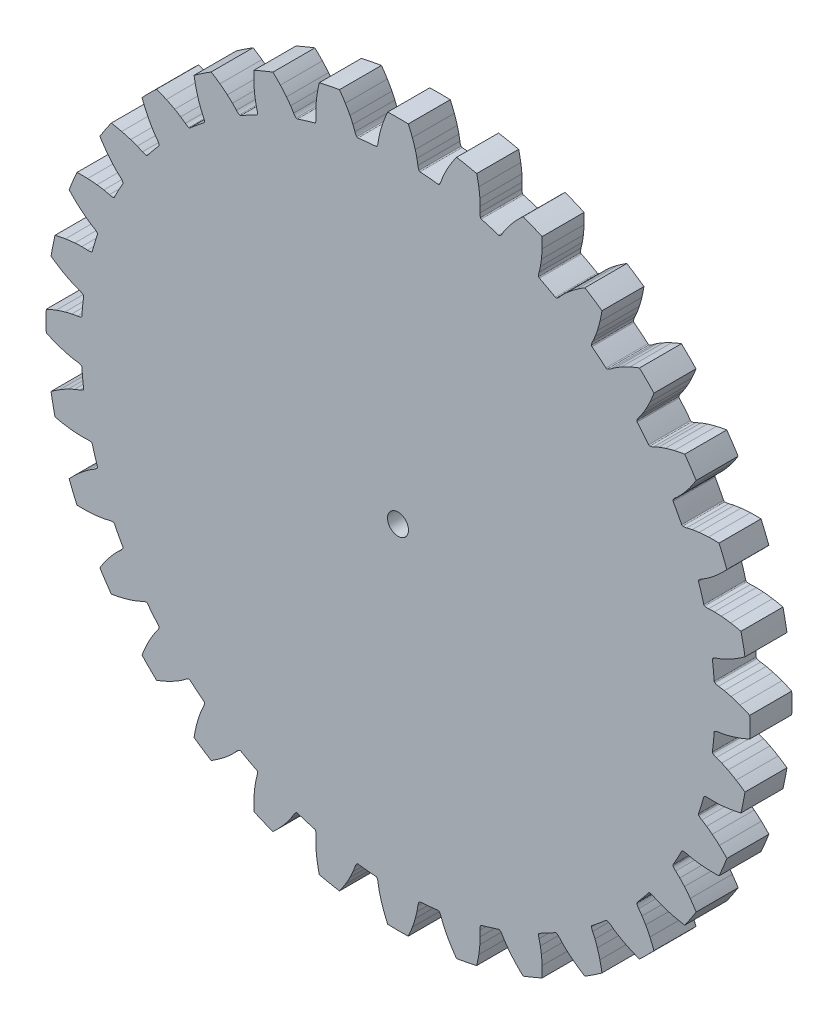
from build123d import *

# Parameters (mm, degrees)
BOSS_EXTRUDE1_DEPTH = 6.35
SKETCH2_R           = 1.5875
CUT_EXTRUDE1_DEPTH  = 76.509747374


with BuildPart() as part:
    # Model → Boss-Extrude1 (new body)
    with BuildSketch(Plane.XY):
        with BuildLine():
            ThreePointArc((47.688684308, -4.696925442), (47.750668499, -4.0181311), (47.802991315, -3.338523772))
            ThreePointArc((47.802991315, -3.338523772), (47.836540789, -3.240219855), (47.914385854, -3.171449418))
            ThreePointArc((47.914385854, -3.171449418), (48.187811806, -3.062492558), (48.475756522, -3.001491007))
            ThreePointArc((48.475756522, -3.001491007), (48.904401032, -2.939153054), (49.330070734, -2.858981734))
            ThreePointArc((49.330070734, -2.858981734), (49.842301009, -2.742156063), (50.350208962, -2.60777748))
            ThreePointArc((50.350208962, -2.60777748), (51.029288231, -2.400648092), (51.699447533, -2.166260071))
            ThreePointArc((51.699447533, -2.166260071), (52.446034926, -1.872790357), (53.181655372, -1.552821976))
            ThreePointArc((53.181655372, -1.552821976), (53.204320541, 0), (53.181655372, 1.552821976))
            ThreePointArc((53.181655372, 1.552821976), (52.446034933, 1.872790354), (51.699447549, 2.166260065))
            ThreePointArc((51.699447549, 2.166260065), (51.029288253, 2.400648085), (50.350208991, 2.607777472))
            ThreePointArc((50.350208991, 2.607777472), (49.84230104, 2.742156056), (49.330070766, 2.858981727))
            ThreePointArc((49.330070766, 2.858981727), (48.904401064, 2.939153049), (48.475756554, 3.001491003))
            ThreePointArc((48.475756554, 3.001491003), (48.187811841, 3.062492546), (47.914385887, 3.171449391))
            ThreePointArc((47.914385887, 3.171449391), (47.836540814, 3.24021982), (47.802991318, 3.338523731))
            ThreePointArc((47.802991318, 3.338523731), (47.68868431, 4.696925421), (47.535783919, 6.051525995))
            ThreePointArc((47.535783919, 6.051525995), (47.549510606, 6.154486207), (47.612443453, 6.237122059))
            ThreePointArc((47.612443453, 6.237122059), (47.859359173, 6.397328101), (48.1298703, 6.513332751))
            ThreePointArc((48.1298703, 6.513332751), (48.538116994, 6.658097293), (48.939966924, 6.819772183))
            ThreePointArc((48.939966924, 6.819772183), (49.419563281, 7.034284251), (49.891495964, 7.265168713))
            ThreePointArc((49.891495964, 7.265168713), (50.517117975, 7.600799961), (51.12867352, 7.961425877))
            ThreePointArc((51.12867352, 7.961425877), (51.803662344, 8.394908626), (52.462725316, 8.852241335))
            ThreePointArc((52.462725316, 8.852241335), (52.182014441, 10.379648027), (51.856844238, 11.898211209))
            ThreePointArc((51.856844238, 11.898211209), (51.072935805, 12.068519056), (50.283440788, 12.210697855))
            ThreePointArc((50.283440788, 12.210697855), (49.58043158, 12.309840583), (48.873991697, 12.380508245))
            ThreePointArc((48.873991697, 12.380508245), (48.349627093, 12.413216856), (47.824447623, 12.427866586))
            ThreePointArc((47.824447623, 12.427866586), (47.391316396, 12.423453399), (46.958746639, 12.400969151))
            ThreePointArc((46.958746639, 12.400969151), (46.664433891, 12.404623339), (46.375005314, 12.458143852))
            ThreePointArc((46.375005314, 12.458143852), (46.285239567, 12.510406057), (46.233156574, 12.600275903))
            ThreePointArc((46.233156574, 12.600275903), (45.856034921, 13.910276095), (45.441803005, 15.209019012))
            ThreePointArc((45.441803005, 15.209019012), (45.435179397, 15.312678816), (45.480781552, 15.406004433))
            ThreePointArc((45.480781552, 15.406004433), (45.691698208, 15.611303028), (45.934380154, 15.777852784))
            ThreePointArc((45.934380154, 15.777852784), (46.306540342, 15.999480695), (46.669127631, 16.236446079))
            ThreePointArc((46.669127631, 16.236446079), (47.09765945, 16.540400966), (47.515480755, 16.858918547))
            ThreePointArc((47.515480755, 16.858918547), (48.063603207, 17.310153534), (48.593053257, 17.783158692))
            ThreePointArc((48.593053257, 17.783158692), (49.170504071, 18.339995979), (49.727682147, 18.917117976))
            ThreePointArc((49.727682147, 18.917117976), (49.154382789, 20.360412001), (48.53920366, 21.786358858))
            ThreePointArc((48.53920366, 21.786358858), (47.737132396, 21.800461339), (46.935069596, 21.785885375))
            ThreePointArc((46.935069596, 21.785885375), (46.226226726, 21.74597281), (45.51957431, 21.677463029))
            ThreePointArc((45.51957431, 21.677463029), (44.998904092, 21.607244694), (44.480957778, 21.519155501))
            ThreePointArc((44.480957778, 21.519155501), (44.057010016, 21.430327401), (43.637138424, 21.323885009))
            ThreePointArc((43.637138424, 21.323885009), (43.347767917, 21.270051415), (43.053459295, 21.266078831))
            ThreePointArc((43.053459295, 21.266078831), (42.955222521, 21.299824404), (42.886607551, 21.377806538))
            ThreePointArc((42.886607551, 21.377806538), (42.261163825, 22.589062659), (41.601519086, 23.782037958))
            ThreePointArc((41.601519086, 23.782037958), (41.574799724, 23.882413766), (41.601318722, 23.982842696))
            ThreePointArc((41.601318722, 23.982842696), (41.768130904, 24.225344334), (41.97365754, 24.436038783))
            ThreePointArc((41.97365754, 24.436038783), (42.295429313, 24.726013026), (42.604819936, 25.029162458))
            ThreePointArc((42.604819936, 25.029162458), (42.965818979, 25.410879347), (43.313472268, 25.804789596))
            ThreePointArc((43.313472268, 25.804789596), (43.763031121, 26.354287614), (44.190029209, 26.921494692))
            ThreePointArc((44.190029209, 26.921494692), (44.647750902, 27.580287572), (45.081632041, 28.255020382))
            ThreePointArc((45.081632041, 28.255020382), (44.237775773, 29.558736761), (43.356228707, 30.837268954))
            ThreePointArc((43.356228707, 30.837268954), (42.566817759, 30.694624119), (41.783010001, 30.523853538))
            ThreePointArc((41.783010001, 30.523853538), (41.095573903, 30.346419498), (40.415865211, 30.141365065))
            ThreePointArc((40.415865211, 30.141365065), (39.918898443, 29.970918235), (39.42808967, 29.783475339))
            ThreePointArc((39.42808967, 29.783475339), (39.029617448, 29.613645941), (38.638579452, 29.427335925))
            ThreePointArc((38.638579452, 29.427335925), (38.365271531, 29.318083343), (38.07739298, 29.256770328))
            ThreePointArc((38.07739298, 29.256770328), (37.974460363, 29.270702445), (37.891950251, 29.333800058))
            ThreePointArc((37.891950251, 29.333800058), (37.042219904, 30.399764214), (36.162512118, 31.441126522))
            ThreePointArc((36.162512118, 31.441126522), (36.116723813, 31.534360948), (36.123140543, 31.638033764))
            ThreePointArc((36.123140543, 31.638033764), (36.239437753, 31.908419244), (36.399910804, 32.155161515))
            ThreePointArc((36.399910804, 32.155161515), (36.658928655, 32.502338544), (36.903232904, 32.860022161))
            ThreePointArc((36.903232904, 32.860022161), (37.182826181, 33.304831886), (37.446951331, 33.758997052))
            ThreePointArc((37.446951331, 33.758997052), (37.780670292, 34.385641202), (38.08880712, 35.025252749))
            ThreePointArc((38.08880712, 35.025252749), (38.409209704, 35.760684181), (38.703120097, 36.5070982))
            ThreePointArc((38.703120097, 36.5070982), (37.621135843, 37.621135843), (36.5070982, 38.703120097))
            ThreePointArc((36.5070982, 38.703120097), (35.760684189, 38.409209707), (35.025252764, 38.088807127))
            ThreePointArc((35.025252764, 38.088807127), (34.385641222, 37.780670303), (33.758997077, 37.446951346))
            ThreePointArc((33.758997077, 37.446951346), (33.304831913, 37.182826197), (32.860022188, 36.903232922))
            ThreePointArc((32.860022188, 36.903232922), (32.50233857, 36.658928674), (32.155161541, 36.399910824))
            ThreePointArc((32.155161541, 36.399910824), (31.908419277, 36.239437769), (31.638033806, 36.123140547))
            ThreePointArc((31.638033806, 36.123140547), (31.53436099, 36.116723805), (31.441126553, 36.162512091))
            ThreePointArc((31.441126553, 36.162512091), (30.399764246, 37.042219878), (29.33380009, 37.891950226))
            ThreePointArc((29.33380009, 37.891950226), (29.27070246, 37.974460324), (29.256770332, 38.077392938))
            ThreePointArc((29.256770332, 38.077392938), (29.318083333, 38.365271496), (29.427335911, 38.638579423))
            ThreePointArc((29.427335911, 38.638579423), (29.613645927, 39.029617418), (29.783475326, 39.42808964))
            ThreePointArc((29.783475326, 39.42808964), (29.970918225, 39.918898413), (30.141365056, 40.415865183))
            ThreePointArc((30.141365056, 40.415865183), (30.346419492, 41.095573881), (30.523853534, 41.783009985))
            ThreePointArc((30.523853534, 41.783009985), (30.694624117, 42.566817751), (30.837268954, 43.356228707))
            ThreePointArc((30.837268954, 43.356228707), (29.558736761, 44.237775773), (28.255020382, 45.081632041))
            ThreePointArc((28.255020382, 45.081632041), (27.580287579, 44.647750906), (26.921494706, 44.190029219))
            ThreePointArc((26.921494706, 44.190029219), (26.354287633, 43.763031136), (25.804789618, 43.313472287))
            ThreePointArc((25.804789618, 43.313472287), (25.41087937, 42.965819), (25.029162482, 42.604819959))
            ThreePointArc((25.029162482, 42.604819959), (24.726013049, 42.295429337), (24.436038804, 41.973657564))
            ThreePointArc((24.436038804, 41.973657564), (24.225344363, 41.768130926), (23.982842736, 41.601318734))
            ThreePointArc((23.982842736, 41.601318734), (23.882413809, 41.574799725), (23.782037994, 41.601519065))
            ThreePointArc((23.782037994, 41.601519065), (22.589062696, 42.261163806), (21.377806575, 42.886607533))
            ThreePointArc((21.377806575, 42.886607533), (21.299824427, 42.955222485), (21.266078844, 43.053459254))
            ThreePointArc((21.266078844, 43.053459254), (21.270051412, 43.34776788), (21.323885001, 43.637138393))
            ThreePointArc((21.323885001, 43.637138393), (21.430327394, 44.057009984), (21.519155495, 44.480957745))
            ThreePointArc((21.519155495, 44.480957745), (21.607244689, 44.998904061), (21.677463025, 45.519574281))
            ThreePointArc((21.677463025, 45.519574281), (21.745972809, 46.226226703), (21.785885375, 46.935069579))
            ThreePointArc((21.785885375, 46.935069579), (21.800461339, 47.737132387), (21.786358858, 48.53920366))
            ThreePointArc((21.786358858, 48.53920366), (20.360412001, 49.154382789), (18.917117976, 49.727682147))
            ThreePointArc((18.917117976, 49.727682147), (18.339995985, 49.170504077), (17.783158704, 48.59305327))
            ThreePointArc((17.783158704, 48.59305327), (17.310153549, 48.063603224), (16.858918565, 47.515480778))
            ThreePointArc((16.858918565, 47.515480778), (16.540400984, 47.097659475), (16.236446098, 46.669127659))
            ThreePointArc((16.236446098, 46.669127659), (15.999480712, 46.30654037), (15.7778528, 45.934380183))
            ThreePointArc((15.7778528, 45.934380183), (15.611303052, 45.691698235), (15.40600447, 45.480781572))
            ThreePointArc((15.40600447, 45.480781572), (15.312678858, 45.435179406), (15.209019052, 45.441802992))
            ThreePointArc((15.209019052, 45.441802992), (13.910276134, 45.856034909), (12.600275943, 46.233156564))
            ThreePointArc((12.600275943, 46.233156564), (12.510406086, 46.285239536), (12.458143872, 46.375005277))
            ThreePointArc((12.458143872, 46.375005277), (12.404623344, 46.664433855), (12.400969149, 46.958746606))
            ThreePointArc((12.400969149, 46.958746606), (12.423453398, 47.391316363), (12.427866586, 47.82444759))
            ThreePointArc((12.427866586, 47.82444759), (12.413216857, 48.349627062), (12.380508247, 48.873991667))
            ThreePointArc((12.380508247, 48.873991667), (12.309840586, 49.580431557), (12.210697858, 50.283440771))
            ThreePointArc((12.210697858, 50.283440771), (12.068519058, 51.072935797), (11.898211209, 51.856844238))
            ThreePointArc((11.898211209, 51.856844238), (10.379648027, 52.182014441), (8.852241335, 52.462725316))
            ThreePointArc((8.852241335, 52.462725316), (8.394908631, 51.803662352), (7.961425885, 51.128673535))
            ThreePointArc((7.961425885, 51.128673535), (7.600799972, 50.517117996), (7.265168727, 49.89149599))
            ThreePointArc((7.265168727, 49.89149599), (7.034284264, 49.419563309), (6.819772196, 48.939966954))
            ThreePointArc((6.819772196, 48.939966954), (6.658097305, 48.538117025), (6.513332761, 48.129870331))
            ThreePointArc((6.513332761, 48.129870331), (6.397328119, 47.859359205), (6.237122092, 47.61244348))
            ThreePointArc((6.237122092, 47.61244348), (6.154486246, 47.549510624), (6.051526036, 47.535783914))
            ThreePointArc((6.051526036, 47.535783914), (4.696925462, 47.688684306), (3.338523772, 47.802991315))
            ThreePointArc((3.338523772, 47.802991315), (3.240219855, 47.836540789), (3.171449418, 47.914385854))
            ThreePointArc((3.171449418, 47.914385854), (3.062492558, 48.187811806), (3.001491007, 48.475756522))
            ThreePointArc((3.001491007, 48.475756522), (2.939153054, 48.904401032), (2.858981734, 49.330070734))
            ThreePointArc((2.858981734, 49.330070734), (2.742156063, 49.842301009), (2.60777748, 50.350208962))
            ThreePointArc((2.60777748, 50.350208962), (2.400648092, 51.029288231), (2.166260071, 51.699447533))
            ThreePointArc((2.166260071, 51.699447533), (1.872790357, 52.446034926), (1.552821976, 53.181655372))
            ThreePointArc((1.552821976, 53.181655372), (0, 53.204320541), (-1.552821976, 53.181655372))
            ThreePointArc((-1.552821976, 53.181655372), (-1.872790354, 52.446034933), (-2.166260065, 51.699447549))
            ThreePointArc((-2.166260065, 51.699447549), (-2.400648085, 51.029288253), (-2.607777472, 50.350208991))
            ThreePointArc((-2.607777472, 50.350208991), (-2.742156056, 49.84230104), (-2.858981727, 49.330070766))
            ThreePointArc((-2.858981727, 49.330070766), (-2.939153049, 48.904401064), (-3.001491003, 48.475756554))
            ThreePointArc((-3.001491003, 48.475756554), (-3.062492546, 48.187811841), (-3.171449391, 47.914385887))
            ThreePointArc((-3.171449391, 47.914385887), (-3.24021982, 47.836540814), (-3.338523731, 47.802991318))
            ThreePointArc((-3.338523731, 47.802991318), (-4.696925421, 47.68868431), (-6.051525995, 47.535783919))
            ThreePointArc((-6.051525995, 47.535783919), (-6.154486207, 47.549510606), (-6.237122059, 47.612443453))
            ThreePointArc((-6.237122059, 47.612443453), (-6.397328101, 47.859359173), (-6.513332751, 48.1298703))
            ThreePointArc((-6.513332751, 48.1298703), (-6.658097293, 48.538116994), (-6.819772183, 48.939966924))
            ThreePointArc((-6.819772183, 48.939966924), (-7.034284251, 49.419563281), (-7.265168713, 49.891495964))
            ThreePointArc((-7.265168713, 49.891495964), (-7.600799961, 50.517117975), (-7.961425877, 51.12867352))
            ThreePointArc((-7.961425877, 51.12867352), (-8.394908626, 51.803662344), (-8.852241335, 52.462725316))
            ThreePointArc((-8.852241335, 52.462725316), (-10.379648027, 52.182014441), (-11.898211209, 51.856844238))
            ThreePointArc((-11.898211209, 51.856844238), (-12.068519056, 51.072935805), (-12.210697855, 50.283440788))
            ThreePointArc((-12.210697855, 50.283440788), (-12.309840583, 49.58043158), (-12.380508245, 48.873991697))
            ThreePointArc((-12.380508245, 48.873991697), (-12.413216856, 48.349627093), (-12.427866586, 47.824447623))
            ThreePointArc((-12.427866586, 47.824447623), (-12.423453399, 47.391316396), (-12.400969151, 46.958746639))
            ThreePointArc((-12.400969151, 46.958746639), (-12.404623339, 46.664433891), (-12.458143852, 46.375005314))
            ThreePointArc((-12.458143852, 46.375005314), (-12.510406057, 46.285239567), (-12.600275903, 46.233156574))
            ThreePointArc((-12.600275903, 46.233156574), (-13.910276095, 45.856034921), (-15.209019012, 45.441803005))
            ThreePointArc((-15.209019012, 45.441803005), (-15.312678816, 45.435179397), (-15.406004433, 45.480781552))
            ThreePointArc((-15.406004433, 45.480781552), (-15.611303028, 45.691698208), (-15.777852784, 45.934380154))
            ThreePointArc((-15.777852784, 45.934380154), (-15.999480695, 46.306540342), (-16.236446079, 46.669127631))
            ThreePointArc((-16.236446079, 46.669127631), (-16.540400966, 47.09765945), (-16.858918547, 47.515480755))
            ThreePointArc((-16.858918547, 47.515480755), (-17.310153534, 48.063603207), (-17.783158692, 48.593053257))
            ThreePointArc((-17.783158692, 48.593053257), (-18.339995979, 49.170504071), (-18.917117976, 49.727682147))
            ThreePointArc((-18.917117976, 49.727682147), (-20.360412001, 49.154382789), (-21.786358858, 48.53920366))
            ThreePointArc((-21.786358858, 48.53920366), (-21.800461339, 47.737132396), (-21.785885375, 46.935069596))
            ThreePointArc((-21.785885375, 46.935069596), (-21.74597281, 46.226226726), (-21.677463029, 45.51957431))
            ThreePointArc((-21.677463029, 45.51957431), (-21.607244694, 44.998904092), (-21.519155501, 44.480957778))
            ThreePointArc((-21.519155501, 44.480957778), (-21.430327401, 44.057010016), (-21.323885009, 43.637138424))
            ThreePointArc((-21.323885009, 43.637138424), (-21.270051415, 43.347767917), (-21.266078831, 43.053459295))
            ThreePointArc((-21.266078831, 43.053459295), (-21.299824404, 42.955222521), (-21.377806538, 42.886607551))
            ThreePointArc((-21.377806538, 42.886607551), (-22.589062659, 42.261163825), (-23.782037958, 41.601519086))
            ThreePointArc((-23.782037958, 41.601519086), (-23.882413766, 41.574799724), (-23.982842696, 41.601318722))
            ThreePointArc((-23.982842696, 41.601318722), (-24.225344334, 41.768130904), (-24.436038783, 41.97365754))
            ThreePointArc((-24.436038783, 41.97365754), (-24.726013026, 42.295429313), (-25.029162458, 42.604819936))
            ThreePointArc((-25.029162458, 42.604819936), (-25.410879347, 42.965818979), (-25.804789596, 43.313472268))
            ThreePointArc((-25.804789596, 43.313472268), (-26.354287614, 43.763031121), (-26.921494692, 44.190029209))
            ThreePointArc((-26.921494692, 44.190029209), (-27.580287572, 44.647750902), (-28.255020382, 45.081632041))
            ThreePointArc((-28.255020382, 45.081632041), (-29.558736761, 44.237775773), (-30.837268954, 43.356228707))
            ThreePointArc((-30.837268954, 43.356228707), (-30.694624119, 42.566817759), (-30.523853538, 41.783010001))
            ThreePointArc((-30.523853538, 41.783010001), (-30.346419498, 41.095573903), (-30.141365065, 40.415865211))
            ThreePointArc((-30.141365065, 40.415865211), (-29.970918235, 39.918898443), (-29.783475339, 39.42808967))
            ThreePointArc((-29.783475339, 39.42808967), (-29.613645941, 39.029617448), (-29.427335925, 38.638579452))
            ThreePointArc((-29.427335925, 38.638579452), (-29.318083343, 38.365271531), (-29.256770328, 38.07739298))
            ThreePointArc((-29.256770328, 38.07739298), (-29.270702445, 37.974460363), (-29.333800058, 37.891950251))
            ThreePointArc((-29.333800058, 37.891950251), (-30.399764214, 37.042219904), (-31.441126522, 36.162512118))
            ThreePointArc((-31.441126522, 36.162512118), (-31.534360948, 36.116723813), (-31.638033764, 36.123140543))
            ThreePointArc((-31.638033764, 36.123140543), (-31.908419244, 36.239437753), (-32.155161515, 36.399910804))
            ThreePointArc((-32.155161515, 36.399910804), (-32.502338544, 36.658928655), (-32.860022161, 36.903232904))
            ThreePointArc((-32.860022161, 36.903232904), (-33.304831886, 37.182826181), (-33.758997052, 37.446951331))
            ThreePointArc((-33.758997052, 37.446951331), (-34.385641202, 37.780670292), (-35.025252749, 38.08880712))
            ThreePointArc((-35.025252749, 38.08880712), (-35.760684181, 38.409209704), (-36.5070982, 38.703120097))
            ThreePointArc((-36.5070982, 38.703120097), (-37.621135843, 37.621135843), (-38.703120097, 36.5070982))
            ThreePointArc((-38.703120097, 36.5070982), (-38.409209707, 35.760684189), (-38.088807127, 35.025252764))
            ThreePointArc((-38.088807127, 35.025252764), (-37.780670303, 34.385641222), (-37.446951346, 33.758997077))
            ThreePointArc((-37.446951346, 33.758997077), (-37.182826197, 33.304831913), (-36.903232922, 32.860022188))
            ThreePointArc((-36.903232922, 32.860022188), (-36.658928674, 32.50233857), (-36.399910824, 32.155161541))
            ThreePointArc((-36.399910824, 32.155161541), (-36.239437769, 31.908419277), (-36.123140547, 31.638033806))
            ThreePointArc((-36.123140547, 31.638033806), (-36.116723805, 31.53436099), (-36.162512091, 31.441126553))
            ThreePointArc((-36.162512091, 31.441126553), (-37.042219878, 30.399764246), (-37.891950226, 29.33380009))
            ThreePointArc((-37.891950226, 29.33380009), (-37.974460324, 29.27070246), (-38.077392938, 29.256770332))
            ThreePointArc((-38.077392938, 29.256770332), (-38.365271496, 29.318083333), (-38.638579423, 29.427335911))
            ThreePointArc((-38.638579423, 29.427335911), (-39.029617418, 29.613645927), (-39.42808964, 29.783475326))
            ThreePointArc((-39.42808964, 29.783475326), (-39.918898413, 29.970918225), (-40.415865183, 30.141365056))
            ThreePointArc((-40.415865183, 30.141365056), (-41.095573881, 30.346419492), (-41.783009985, 30.523853534))
            ThreePointArc((-41.783009985, 30.523853534), (-42.566817751, 30.694624117), (-43.356228707, 30.837268954))
            ThreePointArc((-43.356228707, 30.837268954), (-44.237775773, 29.558736761), (-45.081632041, 28.255020382))
            ThreePointArc((-45.081632041, 28.255020382), (-44.647750906, 27.580287579), (-44.190029219, 26.921494706))
            ThreePointArc((-44.190029219, 26.921494706), (-43.763031136, 26.354287633), (-43.313472287, 25.804789618))
            ThreePointArc((-43.313472287, 25.804789618), (-42.965819, 25.41087937), (-42.604819959, 25.029162482))
            ThreePointArc((-42.604819959, 25.029162482), (-42.295429337, 24.726013049), (-41.973657564, 24.436038804))
            ThreePointArc((-41.973657564, 24.436038804), (-41.768130926, 24.225344363), (-41.601318734, 23.982842736))
            ThreePointArc((-41.601318734, 23.982842736), (-41.574799725, 23.882413809), (-41.601519065, 23.782037994))
            ThreePointArc((-41.601519065, 23.782037994), (-42.261163806, 22.589062696), (-42.886607533, 21.377806575))
            ThreePointArc((-42.886607533, 21.377806575), (-42.955222485, 21.299824427), (-43.053459254, 21.266078844))
            ThreePointArc((-43.053459254, 21.266078844), (-43.34776788, 21.270051412), (-43.637138393, 21.323885001))
            ThreePointArc((-43.637138393, 21.323885001), (-44.057009984, 21.430327394), (-44.480957745, 21.519155495))
            ThreePointArc((-44.480957745, 21.519155495), (-44.998904061, 21.607244689), (-45.519574281, 21.677463025))
            ThreePointArc((-45.519574281, 21.677463025), (-46.226226703, 21.745972809), (-46.935069579, 21.785885375))
            ThreePointArc((-46.935069579, 21.785885375), (-47.737132387, 21.800461339), (-48.53920366, 21.786358858))
            ThreePointArc((-48.53920366, 21.786358858), (-49.154382789, 20.360412001), (-49.727682147, 18.917117976))
            ThreePointArc((-49.727682147, 18.917117976), (-49.170504077, 18.339995985), (-48.59305327, 17.783158704))
            ThreePointArc((-48.59305327, 17.783158704), (-48.063603224, 17.310153549), (-47.515480778, 16.858918565))
            ThreePointArc((-47.515480778, 16.858918565), (-47.097659475, 16.540400984), (-46.669127659, 16.236446098))
            ThreePointArc((-46.669127659, 16.236446098), (-46.30654037, 15.999480712), (-45.934380183, 15.7778528))
            ThreePointArc((-45.934380183, 15.7778528), (-45.691698235, 15.611303052), (-45.480781572, 15.40600447))
            ThreePointArc((-45.480781572, 15.40600447), (-45.435179406, 15.312678858), (-45.441802992, 15.209019052))
            ThreePointArc((-45.441802992, 15.209019052), (-45.856034909, 13.910276134), (-46.233156564, 12.600275943))
            ThreePointArc((-46.233156564, 12.600275943), (-46.285239536, 12.510406086), (-46.375005277, 12.458143872))
            ThreePointArc((-46.375005277, 12.458143872), (-46.664433855, 12.404623344), (-46.958746606, 12.400969149))
            ThreePointArc((-46.958746606, 12.400969149), (-47.391316363, 12.423453398), (-47.82444759, 12.427866586))
            ThreePointArc((-47.82444759, 12.427866586), (-48.349627062, 12.413216857), (-48.873991667, 12.380508247))
            ThreePointArc((-48.873991667, 12.380508247), (-49.580431557, 12.309840586), (-50.283440771, 12.210697858))
            ThreePointArc((-50.283440771, 12.210697858), (-51.072935797, 12.068519058), (-51.856844238, 11.898211209))
            ThreePointArc((-51.856844238, 11.898211209), (-52.182014441, 10.379648027), (-52.462725316, 8.852241335))
            ThreePointArc((-52.462725316, 8.852241335), (-51.803662352, 8.394908631), (-51.128673535, 7.961425885))
            ThreePointArc((-51.128673535, 7.961425885), (-50.517117996, 7.600799972), (-49.89149599, 7.265168727))
            ThreePointArc((-49.89149599, 7.265168727), (-49.419563309, 7.034284264), (-48.939966954, 6.819772196))
            ThreePointArc((-48.939966954, 6.819772196), (-48.538117025, 6.658097305), (-48.129870331, 6.513332761))
            ThreePointArc((-48.129870331, 6.513332761), (-47.859359205, 6.397328119), (-47.61244348, 6.237122092))
            ThreePointArc((-47.61244348, 6.237122092), (-47.549510624, 6.154486246), (-47.535783914, 6.051526036))
            ThreePointArc((-47.535783914, 6.051526036), (-47.688684306, 4.696925462), (-47.802991315, 3.338523772))
            ThreePointArc((-47.802991315, 3.338523772), (-47.836540789, 3.240219855), (-47.914385854, 3.171449418))
            ThreePointArc((-47.914385854, 3.171449418), (-48.187811806, 3.062492558), (-48.475756522, 3.001491007))
            ThreePointArc((-48.475756522, 3.001491007), (-48.904401032, 2.939153054), (-49.330070734, 2.858981734))
            ThreePointArc((-49.330070734, 2.858981734), (-49.842301009, 2.742156063), (-50.350208962, 2.60777748))
            ThreePointArc((-50.350208962, 2.60777748), (-51.029288231, 2.400648092), (-51.699447533, 2.166260071))
            ThreePointArc((-51.699447533, 2.166260071), (-52.446034926, 1.872790357), (-53.181655372, 1.552821976))
            ThreePointArc((-53.181655372, 1.552821976), (-53.204320541, 0), (-53.181655372, -1.552821976))
            ThreePointArc((-53.181655372, -1.552821976), (-52.446034933, -1.872790354), (-51.699447549, -2.166260065))
            ThreePointArc((-51.699447549, -2.166260065), (-51.029288253, -2.400648085), (-50.350208991, -2.607777472))
            ThreePointArc((-50.350208991, -2.607777472), (-49.84230104, -2.742156056), (-49.330070766, -2.858981727))
            ThreePointArc((-49.330070766, -2.858981727), (-48.904401064, -2.939153049), (-48.475756554, -3.001491003))
            ThreePointArc((-48.475756554, -3.001491003), (-48.187811841, -3.062492546), (-47.914385887, -3.171449391))
            ThreePointArc((-47.914385887, -3.171449391), (-47.836540814, -3.24021982), (-47.802991318, -3.338523731))
            ThreePointArc((-47.802991318, -3.338523731), (-47.68868431, -4.696925421), (-47.535783919, -6.051525995))
            ThreePointArc((-47.535783919, -6.051525995), (-47.549510606, -6.154486207), (-47.612443453, -6.237122059))
            ThreePointArc((-47.612443453, -6.237122059), (-47.859359173, -6.397328101), (-48.1298703, -6.513332751))
            ThreePointArc((-48.1298703, -6.513332751), (-48.538116994, -6.658097293), (-48.939966924, -6.819772183))
            ThreePointArc((-48.939966924, -6.819772183), (-49.419563281, -7.034284251), (-49.891495964, -7.265168713))
            ThreePointArc((-49.891495964, -7.265168713), (-50.517117975, -7.600799961), (-51.12867352, -7.961425877))
            ThreePointArc((-51.12867352, -7.961425877), (-51.803662344, -8.394908626), (-52.462725316, -8.852241335))
            ThreePointArc((-52.462725316, -8.852241335), (-52.182014441, -10.379648027), (-51.856844238, -11.898211209))
            ThreePointArc((-51.856844238, -11.898211209), (-51.072935805, -12.068519056), (-50.283440788, -12.210697855))
            ThreePointArc((-50.283440788, -12.210697855), (-49.58043158, -12.309840583), (-48.873991697, -12.380508245))
            ThreePointArc((-48.873991697, -12.380508245), (-48.349627093, -12.413216856), (-47.824447623, -12.427866586))
            ThreePointArc((-47.824447623, -12.427866586), (-47.391316396, -12.423453399), (-46.958746639, -12.400969151))
            ThreePointArc((-46.958746639, -12.400969151), (-46.664433891, -12.404623339), (-46.375005314, -12.458143852))
            ThreePointArc((-46.375005314, -12.458143852), (-46.285239567, -12.510406057), (-46.233156574, -12.600275903))
            ThreePointArc((-46.233156574, -12.600275903), (-45.856034921, -13.910276095), (-45.441803005, -15.209019012))
            ThreePointArc((-45.441803005, -15.209019012), (-45.435179397, -15.312678816), (-45.480781552, -15.406004433))
            ThreePointArc((-45.480781552, -15.406004433), (-45.691698208, -15.611303028), (-45.934380154, -15.777852784))
            ThreePointArc((-45.934380154, -15.777852784), (-46.306540342, -15.999480695), (-46.669127631, -16.236446079))
            ThreePointArc((-46.669127631, -16.236446079), (-47.09765945, -16.540400966), (-47.515480755, -16.858918547))
            ThreePointArc((-47.515480755, -16.858918547), (-48.063603207, -17.310153534), (-48.593053257, -17.783158692))
            ThreePointArc((-48.593053257, -17.783158692), (-49.170504071, -18.339995979), (-49.727682147, -18.917117976))
            ThreePointArc((-49.727682147, -18.917117976), (-49.154382789, -20.360412001), (-48.53920366, -21.786358858))
            ThreePointArc((-48.53920366, -21.786358858), (-47.737132396, -21.800461339), (-46.935069596, -21.785885375))
            ThreePointArc((-46.935069596, -21.785885375), (-46.226226726, -21.74597281), (-45.51957431, -21.677463029))
            ThreePointArc((-45.51957431, -21.677463029), (-44.998904092, -21.607244694), (-44.480957778, -21.519155501))
            ThreePointArc((-44.480957778, -21.519155501), (-44.057010016, -21.430327401), (-43.637138424, -21.323885009))
            ThreePointArc((-43.637138424, -21.323885009), (-43.347767917, -21.270051415), (-43.053459295, -21.266078831))
            ThreePointArc((-43.053459295, -21.266078831), (-42.955222521, -21.299824404), (-42.886607551, -21.377806538))
            ThreePointArc((-42.886607551, -21.377806538), (-42.261163825, -22.589062659), (-41.601519086, -23.782037958))
            ThreePointArc((-41.601519086, -23.782037958), (-41.574799724, -23.882413766), (-41.601318722, -23.982842696))
            ThreePointArc((-41.601318722, -23.982842696), (-41.768130904, -24.225344334), (-41.97365754, -24.436038783))
            ThreePointArc((-41.97365754, -24.436038783), (-42.295429313, -24.726013026), (-42.604819936, -25.029162458))
            ThreePointArc((-42.604819936, -25.029162458), (-42.965818979, -25.410879347), (-43.313472268, -25.804789596))
            ThreePointArc((-43.313472268, -25.804789596), (-43.763031121, -26.354287614), (-44.190029209, -26.921494692))
            ThreePointArc((-44.190029209, -26.921494692), (-44.647750902, -27.580287572), (-45.081632041, -28.255020382))
            ThreePointArc((-45.081632041, -28.255020382), (-44.237775773, -29.558736761), (-43.356228707, -30.837268954))
            ThreePointArc((-43.356228707, -30.837268954), (-42.566817759, -30.694624119), (-41.783010001, -30.523853538))
            ThreePointArc((-41.783010001, -30.523853538), (-41.095573903, -30.346419498), (-40.415865211, -30.141365065))
            ThreePointArc((-40.415865211, -30.141365065), (-39.918898443, -29.970918235), (-39.42808967, -29.783475339))
            ThreePointArc((-39.42808967, -29.783475339), (-39.029617448, -29.613645941), (-38.638579452, -29.427335925))
            ThreePointArc((-38.638579452, -29.427335925), (-38.365271531, -29.318083343), (-38.07739298, -29.256770328))
            ThreePointArc((-38.07739298, -29.256770328), (-37.974460363, -29.270702445), (-37.891950251, -29.333800058))
            ThreePointArc((-37.891950251, -29.333800058), (-37.042219904, -30.399764214), (-36.162512118, -31.441126522))
            ThreePointArc((-36.162512118, -31.441126522), (-36.116723813, -31.534360948), (-36.123140543, -31.638033764))
            ThreePointArc((-36.123140543, -31.638033764), (-36.239437753, -31.908419244), (-36.399910804, -32.155161515))
            ThreePointArc((-36.399910804, -32.155161515), (-36.658928655, -32.502338544), (-36.903232904, -32.860022161))
            ThreePointArc((-36.903232904, -32.860022161), (-37.182826181, -33.304831886), (-37.446951331, -33.758997052))
            ThreePointArc((-37.446951331, -33.758997052), (-37.780670292, -34.385641202), (-38.08880712, -35.025252749))
            ThreePointArc((-38.08880712, -35.025252749), (-38.409209704, -35.760684181), (-38.703120097, -36.5070982))
            ThreePointArc((-38.703120097, -36.5070982), (-37.621135843, -37.621135843), (-36.5070982, -38.703120097))
            ThreePointArc((-36.5070982, -38.703120097), (-35.760684189, -38.409209707), (-35.025252764, -38.088807127))
            ThreePointArc((-35.025252764, -38.088807127), (-34.385641222, -37.780670303), (-33.758997077, -37.446951346))
            ThreePointArc((-33.758997077, -37.446951346), (-33.304831913, -37.182826197), (-32.860022188, -36.903232922))
            ThreePointArc((-32.860022188, -36.903232922), (-32.50233857, -36.658928674), (-32.155161541, -36.399910824))
            ThreePointArc((-32.155161541, -36.399910824), (-31.908419277, -36.239437769), (-31.638033806, -36.123140547))
            ThreePointArc((-31.638033806, -36.123140547), (-31.53436099, -36.116723805), (-31.441126553, -36.162512091))
            ThreePointArc((-31.441126553, -36.162512091), (-30.399764246, -37.042219878), (-29.33380009, -37.891950226))
            ThreePointArc((-29.33380009, -37.891950226), (-29.27070246, -37.974460324), (-29.256770332, -38.077392938))
            ThreePointArc((-29.256770332, -38.077392938), (-29.318083333, -38.365271496), (-29.427335911, -38.638579423))
            ThreePointArc((-29.427335911, -38.638579423), (-29.613645927, -39.029617418), (-29.783475326, -39.42808964))
            ThreePointArc((-29.783475326, -39.42808964), (-29.970918225, -39.918898413), (-30.141365056, -40.415865183))
            ThreePointArc((-30.141365056, -40.415865183), (-30.346419492, -41.095573881), (-30.523853534, -41.783009985))
            ThreePointArc((-30.523853534, -41.783009985), (-30.694624117, -42.566817751), (-30.837268954, -43.356228707))
            ThreePointArc((-30.837268954, -43.356228707), (-29.558736761, -44.237775773), (-28.255020382, -45.081632041))
            ThreePointArc((-28.255020382, -45.081632041), (-27.580287579, -44.647750906), (-26.921494706, -44.190029219))
            ThreePointArc((-26.921494706, -44.190029219), (-26.354287633, -43.763031136), (-25.804789618, -43.313472287))
            ThreePointArc((-25.804789618, -43.313472287), (-25.41087937, -42.965819), (-25.029162482, -42.604819959))
            ThreePointArc((-25.029162482, -42.604819959), (-24.726013049, -42.295429337), (-24.436038804, -41.973657564))
            ThreePointArc((-24.436038804, -41.973657564), (-24.225344363, -41.768130926), (-23.982842736, -41.601318734))
            ThreePointArc((-23.982842736, -41.601318734), (-23.882413809, -41.574799725), (-23.782037994, -41.601519065))
            ThreePointArc((-23.782037994, -41.601519065), (-22.589062696, -42.261163806), (-21.377806575, -42.886607533))
            ThreePointArc((-21.377806575, -42.886607533), (-21.299824427, -42.955222485), (-21.266078844, -43.053459254))
            ThreePointArc((-21.266078844, -43.053459254), (-21.270051412, -43.34776788), (-21.323885001, -43.637138393))
            ThreePointArc((-21.323885001, -43.637138393), (-21.430327394, -44.057009984), (-21.519155495, -44.480957745))
            ThreePointArc((-21.519155495, -44.480957745), (-21.607244689, -44.998904061), (-21.677463025, -45.519574281))
            ThreePointArc((-21.677463025, -45.519574281), (-21.745972809, -46.226226703), (-21.785885375, -46.935069579))
            ThreePointArc((-21.785885375, -46.935069579), (-21.800461339, -47.737132387), (-21.786358858, -48.53920366))
            ThreePointArc((-21.786358858, -48.53920366), (-20.360412001, -49.154382789), (-18.917117976, -49.727682147))
            ThreePointArc((-18.917117976, -49.727682147), (-18.339995985, -49.170504077), (-17.783158704, -48.59305327))
            ThreePointArc((-17.783158704, -48.59305327), (-17.310153549, -48.063603224), (-16.858918565, -47.515480778))
            ThreePointArc((-16.858918565, -47.515480778), (-16.540400984, -47.097659475), (-16.236446098, -46.669127659))
            ThreePointArc((-16.236446098, -46.669127659), (-15.999480712, -46.30654037), (-15.7778528, -45.934380183))
            ThreePointArc((-15.7778528, -45.934380183), (-15.611303052, -45.691698235), (-15.40600447, -45.480781572))
            ThreePointArc((-15.40600447, -45.480781572), (-15.312678858, -45.435179406), (-15.209019052, -45.441802992))
            ThreePointArc((-15.209019052, -45.441802992), (-13.910276134, -45.856034909), (-12.600275943, -46.233156564))
            ThreePointArc((-12.600275943, -46.233156564), (-12.510406086, -46.285239536), (-12.458143872, -46.375005277))
            ThreePointArc((-12.458143872, -46.375005277), (-12.404623344, -46.664433855), (-12.400969149, -46.958746606))
            ThreePointArc((-12.400969149, -46.958746606), (-12.423453398, -47.391316363), (-12.427866586, -47.82444759))
            ThreePointArc((-12.427866586, -47.82444759), (-12.413216857, -48.349627062), (-12.380508247, -48.873991667))
            ThreePointArc((-12.380508247, -48.873991667), (-12.309840586, -49.580431557), (-12.210697858, -50.283440771))
            ThreePointArc((-12.210697858, -50.283440771), (-12.068519058, -51.072935797), (-11.898211209, -51.856844238))
            ThreePointArc((-11.898211209, -51.856844238), (-10.379648027, -52.182014441), (-8.852241335, -52.462725316))
            ThreePointArc((-8.852241335, -52.462725316), (-8.394908631, -51.803662352), (-7.961425885, -51.128673535))
            ThreePointArc((-7.961425885, -51.128673535), (-7.600799972, -50.517117996), (-7.265168727, -49.89149599))
            ThreePointArc((-7.265168727, -49.89149599), (-7.034284264, -49.419563309), (-6.819772196, -48.939966954))
            ThreePointArc((-6.819772196, -48.939966954), (-6.658097305, -48.538117025), (-6.513332761, -48.129870331))
            ThreePointArc((-6.513332761, -48.129870331), (-6.397328119, -47.859359205), (-6.237122092, -47.61244348))
            ThreePointArc((-6.237122092, -47.61244348), (-6.154486246, -47.549510624), (-6.051526036, -47.535783914))
            ThreePointArc((-6.051526036, -47.535783914), (-4.696925462, -47.688684306), (-3.338523772, -47.802991315))
            ThreePointArc((-3.338523772, -47.802991315), (-3.240219855, -47.836540789), (-3.171449418, -47.914385854))
            ThreePointArc((-3.171449418, -47.914385854), (-3.062492558, -48.187811806), (-3.001491007, -48.475756522))
            ThreePointArc((-3.001491007, -48.475756522), (-2.939153054, -48.904401032), (-2.858981734, -49.330070734))
            ThreePointArc((-2.858981734, -49.330070734), (-2.742156063, -49.842301009), (-2.60777748, -50.350208962))
            ThreePointArc((-2.60777748, -50.350208962), (-2.400648092, -51.029288231), (-2.166260071, -51.699447533))
            ThreePointArc((-2.166260071, -51.699447533), (-1.872790357, -52.446034926), (-1.552821976, -53.181655372))
            ThreePointArc((-1.552821976, -53.181655372), (0, -53.204320541), (1.552821976, -53.181655372))
            ThreePointArc((1.552821976, -53.181655372), (1.872790354, -52.446034933), (2.166260065, -51.699447549))
            ThreePointArc((2.166260065, -51.699447549), (2.400648085, -51.029288253), (2.607777472, -50.350208991))
            ThreePointArc((2.607777472, -50.350208991), (2.742156056, -49.84230104), (2.858981727, -49.330070766))
            ThreePointArc((2.858981727, -49.330070766), (2.939153049, -48.904401064), (3.001491003, -48.475756554))
            ThreePointArc((3.001491003, -48.475756554), (3.062492546, -48.187811841), (3.171449391, -47.914385887))
            ThreePointArc((3.171449391, -47.914385887), (3.24021982, -47.836540814), (3.338523731, -47.802991318))
            ThreePointArc((3.338523731, -47.802991318), (4.696925421, -47.68868431), (6.051525995, -47.535783919))
            ThreePointArc((6.051525995, -47.535783919), (6.154486207, -47.549510606), (6.237122059, -47.612443453))
            ThreePointArc((6.237122059, -47.612443453), (6.397328101, -47.859359173), (6.513332751, -48.1298703))
            ThreePointArc((6.513332751, -48.1298703), (6.658097293, -48.538116994), (6.819772183, -48.939966924))
            ThreePointArc((6.819772183, -48.939966924), (7.034284251, -49.419563281), (7.265168713, -49.891495964))
            ThreePointArc((7.265168713, -49.891495964), (7.600799961, -50.517117975), (7.961425877, -51.12867352))
            ThreePointArc((7.961425877, -51.12867352), (8.394908626, -51.803662344), (8.852241335, -52.462725316))
            ThreePointArc((8.852241335, -52.462725316), (10.379648027, -52.182014441), (11.898211209, -51.856844238))
            ThreePointArc((11.898211209, -51.856844238), (12.068519056, -51.072935805), (12.210697855, -50.283440788))
            ThreePointArc((12.210697855, -50.283440788), (12.309840583, -49.58043158), (12.380508245, -48.873991697))
            ThreePointArc((12.380508245, -48.873991697), (12.413216856, -48.349627093), (12.427866586, -47.824447623))
            ThreePointArc((12.427866586, -47.824447623), (12.423453399, -47.391316396), (12.400969151, -46.958746639))
            ThreePointArc((12.400969151, -46.958746639), (12.404623339, -46.664433891), (12.458143852, -46.375005314))
            ThreePointArc((12.458143852, -46.375005314), (12.510406057, -46.285239567), (12.600275903, -46.233156574))
            ThreePointArc((12.600275903, -46.233156574), (13.910276095, -45.856034921), (15.209019012, -45.441803005))
            ThreePointArc((15.209019012, -45.441803005), (15.312678816, -45.435179397), (15.406004433, -45.480781552))
            ThreePointArc((15.406004433, -45.480781552), (15.611303028, -45.691698208), (15.777852784, -45.934380154))
            ThreePointArc((15.777852784, -45.934380154), (15.999480695, -46.306540342), (16.236446079, -46.669127631))
            ThreePointArc((16.236446079, -46.669127631), (16.540400966, -47.09765945), (16.858918547, -47.515480755))
            ThreePointArc((16.858918547, -47.515480755), (17.310153534, -48.063603207), (17.783158692, -48.593053257))
            ThreePointArc((17.783158692, -48.593053257), (18.339995979, -49.170504071), (18.917117976, -49.727682147))
            ThreePointArc((18.917117976, -49.727682147), (20.360412001, -49.154382789), (21.786358858, -48.53920366))
            ThreePointArc((21.786358858, -48.53920366), (21.800461339, -47.737132396), (21.785885375, -46.935069596))
            ThreePointArc((21.785885375, -46.935069596), (21.74597281, -46.226226726), (21.677463029, -45.51957431))
            ThreePointArc((21.677463029, -45.51957431), (21.607244694, -44.998904092), (21.519155501, -44.480957778))
            ThreePointArc((21.519155501, -44.480957778), (21.430327401, -44.057010016), (21.323885009, -43.637138424))
            ThreePointArc((21.323885009, -43.637138424), (21.270051415, -43.347767917), (21.266078831, -43.053459295))
            ThreePointArc((21.266078831, -43.053459295), (21.299824404, -42.955222521), (21.377806538, -42.886607551))
            ThreePointArc((21.377806538, -42.886607551), (22.589062659, -42.261163825), (23.782037958, -41.601519086))
            ThreePointArc((23.782037958, -41.601519086), (23.882413766, -41.574799724), (23.982842696, -41.601318722))
            ThreePointArc((23.982842696, -41.601318722), (24.225344334, -41.768130904), (24.436038783, -41.97365754))
            ThreePointArc((24.436038783, -41.97365754), (24.726013026, -42.295429313), (25.029162458, -42.604819936))
            ThreePointArc((25.029162458, -42.604819936), (25.410879347, -42.965818979), (25.804789596, -43.313472268))
            ThreePointArc((25.804789596, -43.313472268), (26.354287614, -43.763031121), (26.921494692, -44.190029209))
            ThreePointArc((26.921494692, -44.190029209), (27.580287572, -44.647750902), (28.255020382, -45.081632041))
            ThreePointArc((28.255020382, -45.081632041), (29.558736761, -44.237775773), (30.837268954, -43.356228707))
            ThreePointArc((30.837268954, -43.356228707), (30.694624119, -42.566817759), (30.523853538, -41.783010001))
            ThreePointArc((30.523853538, -41.783010001), (30.346419498, -41.095573903), (30.141365065, -40.415865211))
            ThreePointArc((30.141365065, -40.415865211), (29.970918235, -39.918898443), (29.783475339, -39.42808967))
            ThreePointArc((29.783475339, -39.42808967), (29.613645941, -39.029617448), (29.427335925, -38.638579452))
            ThreePointArc((29.427335925, -38.638579452), (29.318083343, -38.365271531), (29.256770328, -38.07739298))
            ThreePointArc((29.256770328, -38.07739298), (29.270702445, -37.974460363), (29.333800058, -37.891950251))
            ThreePointArc((29.333800058, -37.891950251), (30.399764214, -37.042219904), (31.441126522, -36.162512118))
            ThreePointArc((31.441126522, -36.162512118), (31.534360948, -36.116723813), (31.638033764, -36.123140543))
            ThreePointArc((31.638033764, -36.123140543), (31.908419244, -36.239437753), (32.155161515, -36.399910804))
            ThreePointArc((32.155161515, -36.399910804), (32.502338544, -36.658928655), (32.860022161, -36.903232904))
            ThreePointArc((32.860022161, -36.903232904), (33.304831886, -37.182826181), (33.758997052, -37.446951331))
            ThreePointArc((33.758997052, -37.446951331), (34.385641202, -37.780670292), (35.025252749, -38.08880712))
            ThreePointArc((35.025252749, -38.08880712), (35.760684181, -38.409209704), (36.5070982, -38.703120097))
            ThreePointArc((36.5070982, -38.703120097), (37.621135843, -37.621135843), (38.703120097, -36.5070982))
            ThreePointArc((38.703120097, -36.5070982), (38.409209707, -35.760684189), (38.088807127, -35.025252764))
            ThreePointArc((38.088807127, -35.025252764), (37.780670303, -34.385641222), (37.446951346, -33.758997077))
            ThreePointArc((37.446951346, -33.758997077), (37.182826197, -33.304831913), (36.903232922, -32.860022188))
            ThreePointArc((36.903232922, -32.860022188), (36.658928674, -32.50233857), (36.399910824, -32.155161541))
            ThreePointArc((36.399910824, -32.155161541), (36.239437769, -31.908419277), (36.123140547, -31.638033806))
            ThreePointArc((36.123140547, -31.638033806), (36.116723805, -31.53436099), (36.162512091, -31.441126553))
            ThreePointArc((36.162512091, -31.441126553), (37.042219878, -30.399764246), (37.891950226, -29.33380009))
            ThreePointArc((37.891950226, -29.33380009), (37.974460324, -29.27070246), (38.077392938, -29.256770332))
            ThreePointArc((38.077392938, -29.256770332), (38.365271496, -29.318083333), (38.638579423, -29.427335911))
            ThreePointArc((38.638579423, -29.427335911), (39.029617418, -29.613645927), (39.42808964, -29.783475326))
            ThreePointArc((39.42808964, -29.783475326), (39.918898413, -29.970918225), (40.415865183, -30.141365056))
            ThreePointArc((40.415865183, -30.141365056), (41.095573881, -30.346419492), (41.783009985, -30.523853534))
            ThreePointArc((41.783009985, -30.523853534), (42.566817751, -30.694624117), (43.356228707, -30.837268954))
            ThreePointArc((43.356228707, -30.837268954), (44.237775773, -29.558736761), (45.081632041, -28.255020382))
            ThreePointArc((45.081632041, -28.255020382), (44.647750906, -27.580287579), (44.190029219, -26.921494706))
            ThreePointArc((44.190029219, -26.921494706), (43.763031136, -26.354287633), (43.313472287, -25.804789618))
            ThreePointArc((43.313472287, -25.804789618), (42.965819, -25.41087937), (42.604819959, -25.029162482))
            ThreePointArc((42.604819959, -25.029162482), (42.295429337, -24.726013049), (41.973657564, -24.436038804))
            ThreePointArc((41.973657564, -24.436038804), (41.768130926, -24.225344363), (41.601318734, -23.982842736))
            ThreePointArc((41.601318734, -23.982842736), (41.574799725, -23.882413809), (41.601519065, -23.782037994))
            ThreePointArc((41.601519065, -23.782037994), (42.261163806, -22.589062696), (42.886607533, -21.377806575))
            ThreePointArc((42.886607533, -21.377806575), (42.955222485, -21.299824427), (43.053459254, -21.266078844))
            ThreePointArc((43.053459254, -21.266078844), (43.34776788, -21.270051412), (43.637138393, -21.323885001))
            ThreePointArc((43.637138393, -21.323885001), (44.057009984, -21.430327394), (44.480957745, -21.519155495))
            ThreePointArc((44.480957745, -21.519155495), (44.998904061, -21.607244689), (45.519574281, -21.677463025))
            ThreePointArc((45.519574281, -21.677463025), (46.226226703, -21.745972809), (46.935069579, -21.785885375))
            ThreePointArc((46.935069579, -21.785885375), (47.737132387, -21.800461339), (48.53920366, -21.786358858))
            ThreePointArc((48.53920366, -21.786358858), (49.154382789, -20.360412001), (49.727682147, -18.917117976))
            ThreePointArc((49.727682147, -18.917117976), (49.170504077, -18.339995985), (48.59305327, -17.783158704))
            ThreePointArc((48.59305327, -17.783158704), (48.063603224, -17.310153549), (47.515480778, -16.858918565))
            ThreePointArc((47.515480778, -16.858918565), (47.097659475, -16.540400984), (46.669127659, -16.236446098))
            ThreePointArc((46.669127659, -16.236446098), (46.30654037, -15.999480712), (45.934380183, -15.7778528))
            ThreePointArc((45.934380183, -15.7778528), (45.691698235, -15.611303052), (45.480781572, -15.40600447))
            ThreePointArc((45.480781572, -15.40600447), (45.435179406, -15.312678858), (45.441802992, -15.209019052))
            ThreePointArc((45.441802992, -15.209019052), (45.856034909, -13.910276134), (46.233156564, -12.600275943))
            ThreePointArc((46.233156564, -12.600275943), (46.285239536, -12.510406086), (46.375005277, -12.458143872))
            ThreePointArc((46.375005277, -12.458143872), (46.664433855, -12.404623344), (46.958746606, -12.400969149))
            ThreePointArc((46.958746606, -12.400969149), (47.391316363, -12.423453398), (47.82444759, -12.427866586))
            ThreePointArc((47.82444759, -12.427866586), (48.349627062, -12.413216857), (48.873991667, -12.380508247))
            ThreePointArc((48.873991667, -12.380508247), (49.580431557, -12.309840586), (50.283440771, -12.210697858))
            ThreePointArc((50.283440771, -12.210697858), (51.072935797, -12.068519058), (51.856844238, -11.898211209))
            ThreePointArc((51.856844238, -11.898211209), (52.182014441, -10.379648027), (52.462725316, -8.852241335))
            ThreePointArc((52.462725316, -8.852241335), (51.803662352, -8.394908631), (51.128673535, -7.961425885))
            ThreePointArc((51.128673535, -7.961425885), (50.517117996, -7.600799972), (49.89149599, -7.265168727))
            ThreePointArc((49.89149599, -7.265168727), (49.419563309, -7.034284264), (48.939966954, -6.819772196))
            ThreePointArc((48.939966954, -6.819772196), (48.538117025, -6.658097305), (48.129870331, -6.513332761))
            ThreePointArc((48.129870331, -6.513332761), (47.859359205, -6.397328119), (47.61244348, -6.237122092))
            ThreePointArc((47.61244348, -6.237122092), (47.549510624, -6.154486246), (47.535783914, -6.051526036))
            ThreePointArc((47.535783914, -6.051526036), (47.617051281, -5.374769477), (47.688684308, -4.696925442))
        make_face()
    extrude(amount=BOSS_EXTRUDE1_DEPTH)

    # Sketch2 → Cut-Extrude1 (cut, through all)
    with BuildSketch(Plane.XY.offset(6.35)):
        Circle(SKETCH2_R)
    extrude(amount=-CUT_EXTRUDE1_DEPTH, mode=Mode.SUBTRACT)


solid = part.part
